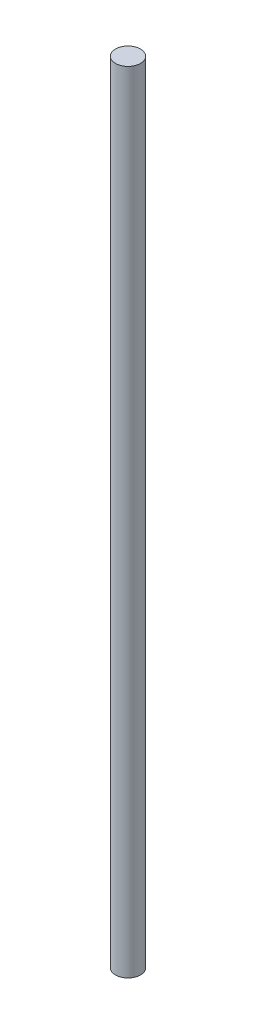
from build123d import *

# Parameters (mm, degrees)
SKETCH1_R           = 1.5875
BOSS_EXTRUDE1_DEPTH = 100.33


with BuildPart() as part:
    # Sketch1 → Boss-Extrude1 (new body)
    with BuildSketch(Plane(origin=(0, 0, 0), x_dir=(1, 0, 0), z_dir=(0, 1, 0))):
        Circle(SKETCH1_R)
    extrude(amount=BOSS_EXTRUDE1_DEPTH)


solid = part.part
